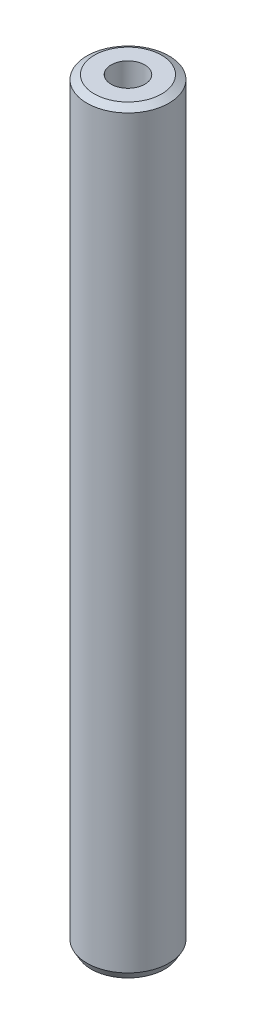
from build123d import *
from OCP.BRepFilletAPI import BRepFilletAPI_MakeChamfer

# Parameters (mm, degrees)
SKETCH1_R           = 20
BOSS_EXTRUDE1_DEPTH = 368.727452449
SKETCH2_R           = 8.201000698
CUT_EXTRUDE1_DEPTH  = 370.810673439
CHAMFER1_SIZE       = 2.08044505
CHAMFER1_SIZE2      = 3.603436529


with BuildPart() as part:
    # Sketch1 → Boss-Extrude1 (new body)
    with BuildSketch(Plane(origin=(0, 0, 0), x_dir=(1, 0, 0), z_dir=(0, 1, 0))):
        Circle(SKETCH1_R)
    extrude(amount=BOSS_EXTRUDE1_DEPTH)

    # Sketch2 → Cut-Extrude1 (cut, through all)
    with BuildSketch(Plane(origin=(0, 0, 0), x_dir=(1, 0, 0), z_dir=(0, 1, 0))):
        Circle(SKETCH2_R)
    extrude(amount=CUT_EXTRUDE1_DEPTH, mode=Mode.SUBTRACT)

    # Chamfer1: one chamfer whose edges measure the first distance from different faces: ONE call of the kernel's chamfer builder (chamfer() names one face for all edges)
    chamfer1_edges_1 = [part.edges().sort_by_distance(p)[0] for p in [
        (-20, 368.727452449, 0),
    ]]
    chamfer1_side_1 = [part.faces().sort_by_distance(p)[0] for p in [
        (-20, 184.363726224, 0),
    ]]
    chamfer1_edges_2 = [part.edges().sort_by_distance(p)[0] for p in [
        (-20, 0, 0),
    ]]
    chamfer1_side_2 = [part.faces().sort_by_distance(p)[0] for p in [
        (-19.434314575, 0, 0),
    ]]
    chamfer1 = BRepFilletAPI_MakeChamfer(part.part.solid().wrapped)
    for e in chamfer1_edges_1:
        chamfer1.Add(CHAMFER1_SIZE, CHAMFER1_SIZE2, e.wrapped, chamfer1_side_1[0].wrapped)  # the first distance lies on this face
    for e in chamfer1_edges_2:
        chamfer1.Add(CHAMFER1_SIZE, CHAMFER1_SIZE2, e.wrapped, chamfer1_side_2[0].wrapped)  # the first distance lies on this face
    add(Compound.cast(chamfer1.Shape()), mode=Mode.REPLACE)


solid = part.part
